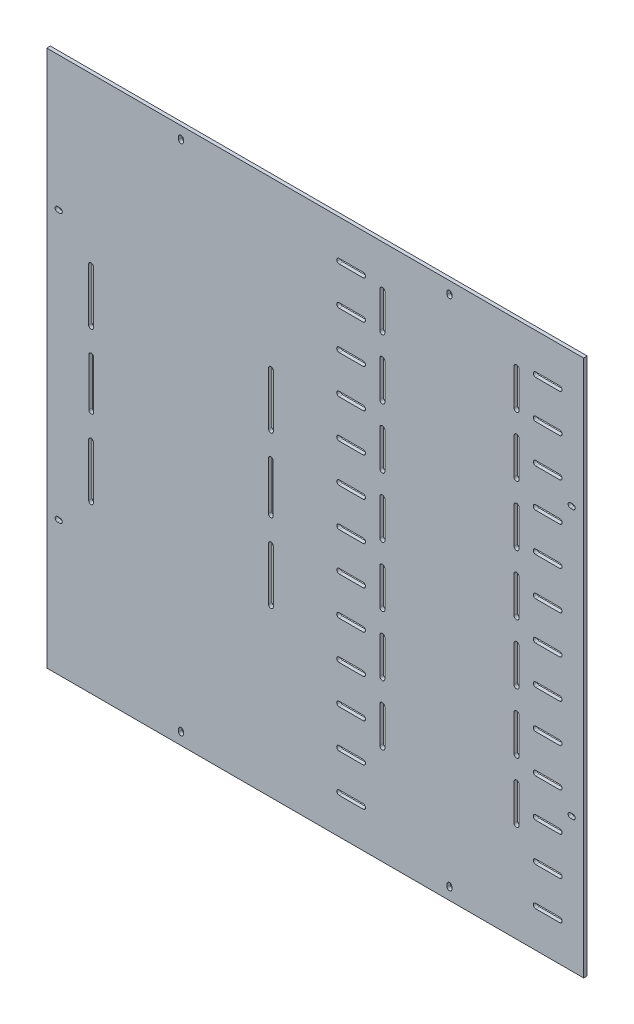
from build123d import *

# Parameters (mm, degrees)
SCHIZZO1_W                   = 448
SCHIZZO1_H                   = 448
ESTRUSIONE_ESTRUSIONE1_DEPTH = 3


with BuildPart() as part:
    # Schizzo1 → Estrusione-Estrusione1 (new body)
    with BuildSketch(Plane.XY):
        with Locations((224, 224)):
            Rectangle(SCHIZZO1_W, SCHIZZO1_H)
        with BuildLine():
            Line((9, 338), (11, 338))
            ThreePointArc((11, 338), (13, 336), (11, 334))
            Line((11, 334), (9, 334))
            ThreePointArc((9, 334), (7, 336), (9, 338))
        make_face(mode=Mode.SUBTRACT)
        with BuildLine():
            Line((9, 110), (11, 110))
            ThreePointArc((11, 110), (13, 112), (11, 114))
            Line((11, 114), (9, 114))
            ThreePointArc((9, 114), (7, 112), (9, 110))
        make_face(mode=Mode.SUBTRACT)
        with BuildLine():
            Line((439, 110), (437, 110))
            ThreePointArc((437, 110), (435, 112), (437, 114))
            Line((437, 114), (439, 114))
            ThreePointArc((439, 114), (441, 112), (439, 110))
        make_face(mode=Mode.SUBTRACT)
        with BuildLine():
            Line((439, 338), (437, 338))
            ThreePointArc((437, 338), (435, 336), (437, 334))
            Line((437, 334), (439, 334))
            ThreePointArc((439, 334), (441, 336), (439, 338))
        make_face(mode=Mode.SUBTRACT)
        with BuildLine():
            Line((114, 439), (114, 437))
            ThreePointArc((114, 437), (112, 435), (110, 437))
            Line((110, 437), (110, 439))
            ThreePointArc((110, 439), (112, 441), (114, 439))
        make_face(mode=Mode.SUBTRACT)
        with BuildLine():
            Line((334, 439), (334, 437))
            ThreePointArc((334, 437), (336, 435), (338, 437))
            Line((338, 437), (338, 439))
            ThreePointArc((338, 439), (336, 441), (334, 439))
        make_face(mode=Mode.SUBTRACT)
        with BuildLine():
            Line((114, 9), (114, 11))
            ThreePointArc((114, 11), (112, 13), (110, 11))
            Line((110, 11), (110, 9))
            ThreePointArc((110, 9), (112, 7), (114, 9))
        make_face(mode=Mode.SUBTRACT)
        with BuildLine():
            Line((334, 9), (334, 11))
            ThreePointArc((334, 11), (336, 13), (338, 11))
            Line((338, 11), (338, 9))
            ThreePointArc((338, 9), (336, 7), (334, 9))
        make_face(mode=Mode.SUBTRACT)
        with BuildLine():
            Line((34.958788995, 265.366145204), (34.958788995, 309.366145204))
            ThreePointArc((34.958788995, 309.366145204), (36.958788995, 311.366145204), (38.958788995, 309.366145204))
            Line((38.958788995, 309.366145204), (38.958788995, 265.366145204))
            ThreePointArc((38.958788995, 265.366145204), (36.958788995, 263.366145204), (34.958788995, 265.366145204))
        make_face(mode=Mode.SUBTRACT)
        with BuildLine():
            Line((34.958788995, 182.633854796), (34.958788995, 138.633854796))
            ThreePointArc((34.958788995, 138.633854796), (36.958788995, 136.633854796), (38.958788995, 138.633854796))
            Line((38.958788995, 138.633854796), (38.958788995, 182.633854796))
            ThreePointArc((38.958788995, 182.633854796), (36.958788995, 184.633854796), (34.958788995, 182.633854796))
        make_face(mode=Mode.SUBTRACT)
        with BuildLine():
            Line((35.086959829, 204.138830615), (35.086959829, 244.138830615))
            ThreePointArc((35.086959829, 244.138830615), (37.086959829, 246.138830615), (39.086959829, 244.138830615))
            Line((39.086959829, 244.138830615), (39.086959829, 204.138830615))
            ThreePointArc((39.086959829, 204.138830615), (37.086959829, 202.138830615), (35.086959829, 204.138830615))
        make_face(mode=Mode.SUBTRACT)
        with BuildLine():
            Line((189.041211005, 265.366145204), (189.041211005, 309.366145204))
            ThreePointArc((189.041211005, 309.366145204), (187.041211005, 311.366145204), (185.041211005, 309.366145204))
            Line((185.041211005, 309.366145204), (185.041211005, 265.366145204))
            ThreePointArc((185.041211005, 265.366145204), (187.041211005, 263.366145204), (189.041211005, 265.366145204))
        make_face(mode=Mode.SUBTRACT)
        with BuildLine():
            Line((188.913040171, 204.138830615), (188.913040171, 244.138830615))
            ThreePointArc((188.913040171, 244.138830615), (186.913040171, 246.138830615), (184.913040171, 244.138830615))
            Line((184.913040171, 244.138830615), (184.913040171, 204.138830615))
            ThreePointArc((184.913040171, 204.138830615), (186.913040171, 202.138830615), (188.913040171, 204.138830615))
        make_face(mode=Mode.SUBTRACT)
        with BuildLine():
            Line((189.041211005, 182.633854796), (189.041211005, 138.633854796))
            ThreePointArc((189.041211005, 138.633854796), (187.041211005, 136.633854796), (185.041211005, 138.633854796))
            Line((185.041211005, 138.633854796), (185.041211005, 182.633854796))
            ThreePointArc((185.041211005, 182.633854796), (187.041211005, 184.633854796), (189.041211005, 182.633854796))
        make_face(mode=Mode.SUBTRACT)
        with BuildLine():
            Line((243.970716252, 418), (263.970716252, 418))
            ThreePointArc((263.970716252, 418), (265.970716252, 416), (263.970716252, 414))
            Line((263.970716252, 414), (243.970716252, 414))
            ThreePointArc((243.970716252, 414), (241.970716252, 416), (243.970716252, 418))
        make_face(mode=Mode.SUBTRACT)
        with BuildLine():
            Line((427.970329998, 418.017724106), (407.970330369, 418.013871032))
            ThreePointArc((407.970330369, 418.013871032), (405.970715714, 416.013485761), (407.971100984, 414.013871106))
            Line((407.971100984, 414.013871106), (427.971100613, 414.017724181))
            ThreePointArc((427.971100613, 414.017724181), (429.970715268, 416.018109451), (427.970329998, 418.017724106))
        make_face(mode=Mode.SUBTRACT)
        with BuildLine():
            Line((243.970716252, 386), (263.970716252, 386))
            ThreePointArc((263.970716252, 386), (265.970716252, 384), (263.970716252, 382))
            Line((263.970716252, 382), (243.970716252, 382))
            ThreePointArc((243.970716252, 382), (241.970716252, 384), (243.970716252, 386))
        make_face(mode=Mode.SUBTRACT)
        with BuildLine():
            Line((427.970329998, 386.017724106), (407.970330369, 386.013871032))
            ThreePointArc((407.970330369, 386.013871032), (405.970715714, 384.013485761), (407.971100984, 382.013871106))
            Line((407.971100984, 382.013871106), (427.971100613, 382.017724181))
            ThreePointArc((427.971100613, 382.017724181), (429.970715268, 384.018109451), (427.970329998, 386.017724106))
        make_face(mode=Mode.SUBTRACT)
        with BuildLine():
            Line((277.872450261, 383.004982615), (277.872450261, 412.995017385))
            ThreePointArc((277.872450261, 412.995017385), (279.972450256, 415.09501738), (282.072450251, 412.995017385))
            Line((282.072450251, 412.995017385), (282.072450251, 383.004982615))
            ThreePointArc((282.072450251, 383.004982615), (279.972450256, 380.90498262), (277.872450261, 383.004982615))
        make_face(mode=Mode.SUBTRACT)
        with BuildLine():
            Line((243.970716252, 354), (263.970716252, 354))
            ThreePointArc((263.970716252, 354), (265.970716252, 352), (263.970716252, 350))
            Line((263.970716252, 350), (243.970716252, 350))
            ThreePointArc((243.970716252, 350), (241.970716252, 352), (243.970716252, 354))
        make_face(mode=Mode.SUBTRACT)
        with BuildLine():
            Line((427.970329998, 354.017724106), (407.970330369, 354.013871032))
            ThreePointArc((407.970330369, 354.013871032), (405.970715714, 352.013485761), (407.971100984, 350.013871106))
            Line((407.971100984, 350.013871106), (427.971100613, 350.017724181))
            ThreePointArc((427.971100613, 350.017724181), (429.970715268, 352.018109451), (427.970329998, 354.017724106))
        make_face(mode=Mode.SUBTRACT)
        with BuildLine():
            Line((243.970716252, 322), (263.970716252, 322))
            ThreePointArc((263.970716252, 322), (265.970716252, 320), (263.970716252, 318))
            Line((263.970716252, 318), (243.970716252, 318))
            ThreePointArc((243.970716252, 318), (241.970716252, 320), (243.970716252, 322))
        make_face(mode=Mode.SUBTRACT)
        with BuildLine():
            Line((427.970329998, 322.017724106), (407.970330369, 322.013871032))
            ThreePointArc((407.970330369, 322.013871032), (405.970715714, 320.013485761), (407.971100984, 318.013871106))
            Line((407.971100984, 318.013871106), (427.971100613, 318.017724181))
            ThreePointArc((427.971100613, 318.017724181), (429.970715268, 320.018109451), (427.970329998, 322.017724106))
        make_face(mode=Mode.SUBTRACT)
        with BuildLine():
            Line((394.072449736, 383.005806193), (394.072449736, 413.015771025))
            ThreePointArc((394.072449736, 413.015771025), (391.972449736, 415.115771025), (389.872449736, 413.015771025))
            Line((389.872449736, 413.015771025), (389.872449736, 383.005806193))
            ThreePointArc((389.872449736, 383.005806193), (391.972449736, 380.905806193), (394.072449736, 383.005806193))
        make_face(mode=Mode.SUBTRACT)
        with BuildLine():
            Line((243.970716252, 290), (263.970716252, 290))
            ThreePointArc((263.970716252, 290), (265.970716252, 288), (263.970716252, 286))
            Line((263.970716252, 286), (243.970716252, 286))
            ThreePointArc((243.970716252, 286), (241.970716252, 288), (243.970716252, 290))
        make_face(mode=Mode.SUBTRACT)
        with BuildLine():
            Line((427.970329998, 290.017724106), (407.970330369, 290.013871032))
            ThreePointArc((407.970330369, 290.013871032), (405.970715714, 288.013485761), (407.971100984, 286.013871106))
            Line((407.971100984, 286.013871106), (427.971100613, 286.017724181))
            ThreePointArc((427.971100613, 286.017724181), (429.970715268, 288.018109451), (427.970329998, 290.017724106))
        make_face(mode=Mode.SUBTRACT)
        with BuildLine():
            Line((243.970716252, 258), (263.970716252, 258))
            ThreePointArc((263.970716252, 258), (265.970716252, 256), (263.970716252, 254))
            Line((263.970716252, 254), (243.970716252, 254))
            ThreePointArc((243.970716252, 254), (241.970716252, 256), (243.970716252, 258))
        make_face(mode=Mode.SUBTRACT)
        with BuildLine():
            Line((427.970329998, 258.017724106), (407.970330369, 258.013871032))
            ThreePointArc((407.970330369, 258.013871032), (405.970715714, 256.013485761), (407.971100984, 254.013871106))
            Line((407.971100984, 254.013871106), (427.971100613, 254.017724181))
            ThreePointArc((427.971100613, 254.017724181), (429.970715268, 256.018109451), (427.970329998, 258.017724106))
        make_face(mode=Mode.SUBTRACT)
        with BuildLine():
            Line((243.970716252, 226), (263.970716252, 226))
            ThreePointArc((263.970716252, 226), (265.970716252, 224), (263.970716252, 222))
            Line((263.970716252, 222), (243.970716252, 222))
            ThreePointArc((243.970716252, 222), (241.970716252, 224), (243.970716252, 226))
        make_face(mode=Mode.SUBTRACT)
        with BuildLine():
            Line((427.970329998, 226.017724106), (407.970330369, 226.013871032))
            ThreePointArc((407.970330369, 226.013871032), (405.970715714, 224.013485761), (407.971100984, 222.013871106))
            Line((407.971100984, 222.013871106), (427.971100613, 222.017724181))
            ThreePointArc((427.971100613, 222.017724181), (429.970715268, 224.018109451), (427.970329998, 226.017724106))
        make_face(mode=Mode.SUBTRACT)
        with BuildLine():
            Line((243.970716252, 194), (263.970716252, 194))
            ThreePointArc((263.970716252, 194), (265.970716252, 192), (263.970716252, 190))
            Line((263.970716252, 190), (243.970716252, 190))
            ThreePointArc((243.970716252, 190), (241.970716252, 192), (243.970716252, 194))
        make_face(mode=Mode.SUBTRACT)
        with BuildLine():
            Line((427.970329998, 194.017724106), (407.970330369, 194.013871032))
            ThreePointArc((407.970330369, 194.013871032), (405.970715714, 192.013485761), (407.971100984, 190.013871106))
            Line((407.971100984, 190.013871106), (427.971100613, 190.017724181))
            ThreePointArc((427.971100613, 190.017724181), (429.970715268, 192.018109451), (427.970329998, 194.017724106))
        make_face(mode=Mode.SUBTRACT)
        with BuildLine():
            Line((243.970716252, 162), (263.970716252, 162))
            ThreePointArc((263.970716252, 162), (265.970716252, 160), (263.970716252, 158))
            Line((263.970716252, 158), (243.970716252, 158))
            ThreePointArc((243.970716252, 158), (241.970716252, 160), (243.970716252, 162))
        make_face(mode=Mode.SUBTRACT)
        with BuildLine():
            Line((427.970329998, 162.017724106), (407.970330369, 162.013871032))
            ThreePointArc((407.970330369, 162.013871032), (405.970715714, 160.013485761), (407.971100984, 158.013871106))
            Line((407.971100984, 158.013871106), (427.971100613, 158.017724181))
            ThreePointArc((427.971100613, 158.017724181), (429.970715268, 160.018109451), (427.970329998, 162.017724106))
        make_face(mode=Mode.SUBTRACT)
        with BuildLine():
            Line((243.970716252, 130), (263.970716252, 130))
            ThreePointArc((263.970716252, 130), (265.970716252, 128), (263.970716252, 126))
            Line((263.970716252, 126), (243.970716252, 126))
            ThreePointArc((243.970716252, 126), (241.970716252, 128), (243.970716252, 130))
        make_face(mode=Mode.SUBTRACT)
        with BuildLine():
            Line((427.970329998, 130.017724106), (407.970330369, 130.013871032))
            ThreePointArc((407.970330369, 130.013871032), (405.970715714, 128.013485761), (407.971100984, 126.013871106))
            Line((407.971100984, 126.013871106), (427.971100613, 126.017724181))
            ThreePointArc((427.971100613, 126.017724181), (429.970715268, 128.018109451), (427.970329998, 130.017724106))
        make_face(mode=Mode.SUBTRACT)
        with BuildLine():
            Line((277.872450261, 333.004982615), (277.872450261, 362.995017385))
            ThreePointArc((277.872450261, 362.995017385), (279.972450256, 365.09501738), (282.072450251, 362.995017385))
            Line((282.072450251, 362.995017385), (282.072450251, 333.004982615))
            ThreePointArc((282.072450251, 333.004982615), (279.972450256, 330.90498262), (277.872450261, 333.004982615))
        make_face(mode=Mode.SUBTRACT)
        with BuildLine():
            Line((394.072449736, 333.005806193), (394.072449736, 363.015771025))
            ThreePointArc((394.072449736, 363.015771025), (391.972449736, 365.115771025), (389.872449736, 363.015771025))
            Line((389.872449736, 363.015771025), (389.872449736, 333.005806193))
            ThreePointArc((389.872449736, 333.005806193), (391.972449736, 330.905806193), (394.072449736, 333.005806193))
        make_face(mode=Mode.SUBTRACT)
        with BuildLine():
            Line((277.872450261, 283.004982615), (277.872450261, 312.995017385))
            ThreePointArc((277.872450261, 312.995017385), (279.972450256, 315.09501738), (282.072450251, 312.995017385))
            Line((282.072450251, 312.995017385), (282.072450251, 283.004982615))
            ThreePointArc((282.072450251, 283.004982615), (279.972450256, 280.90498262), (277.872450261, 283.004982615))
        make_face(mode=Mode.SUBTRACT)
        with BuildLine():
            Line((394.072449736, 283.005806193), (394.072449736, 313.015771025))
            ThreePointArc((394.072449736, 313.015771025), (391.972449736, 315.115771025), (389.872449736, 313.015771025))
            Line((389.872449736, 313.015771025), (389.872449736, 283.005806193))
            ThreePointArc((389.872449736, 283.005806193), (391.972449736, 280.905806193), (394.072449736, 283.005806193))
        make_face(mode=Mode.SUBTRACT)
        with BuildLine():
            Line((277.872450261, 233.004982615), (277.872450261, 262.995017385))
            ThreePointArc((277.872450261, 262.995017385), (279.972450256, 265.09501738), (282.072450251, 262.995017385))
            Line((282.072450251, 262.995017385), (282.072450251, 233.004982615))
            ThreePointArc((282.072450251, 233.004982615), (279.972450256, 230.90498262), (277.872450261, 233.004982615))
        make_face(mode=Mode.SUBTRACT)
        with BuildLine():
            Line((394.072449736, 233.005806193), (394.072449736, 263.015771025))
            ThreePointArc((394.072449736, 263.015771025), (391.972449736, 265.115771025), (389.872449736, 263.015771025))
            Line((389.872449736, 263.015771025), (389.872449736, 233.005806193))
            ThreePointArc((389.872449736, 233.005806193), (391.972449736, 230.905806193), (394.072449736, 233.005806193))
        make_face(mode=Mode.SUBTRACT)
        with BuildLine():
            Line((277.872450261, 183.004982615), (277.872450261, 212.995017385))
            ThreePointArc((277.872450261, 212.995017385), (279.972450256, 215.09501738), (282.072450251, 212.995017385))
            Line((282.072450251, 212.995017385), (282.072450251, 183.004982615))
            ThreePointArc((282.072450251, 183.004982615), (279.972450256, 180.90498262), (277.872450261, 183.004982615))
        make_face(mode=Mode.SUBTRACT)
        with BuildLine():
            Line((394.072449736, 183.005806193), (394.072449736, 213.015771025))
            ThreePointArc((394.072449736, 213.015771025), (391.972449736, 215.115771025), (389.872449736, 213.015771025))
            Line((389.872449736, 213.015771025), (389.872449736, 183.005806193))
            ThreePointArc((389.872449736, 183.005806193), (391.972449736, 180.905806193), (394.072449736, 183.005806193))
        make_face(mode=Mode.SUBTRACT)
        with BuildLine():
            Line((277.872450261, 133.004982615), (277.872450261, 162.995017385))
            ThreePointArc((277.872450261, 162.995017385), (279.972450256, 165.09501738), (282.072450251, 162.995017385))
            Line((282.072450251, 162.995017385), (282.072450251, 133.004982615))
            ThreePointArc((282.072450251, 133.004982615), (279.972450256, 130.90498262), (277.872450261, 133.004982615))
        make_face(mode=Mode.SUBTRACT)
        with BuildLine():
            Line((394.072449736, 133.005806193), (394.072449736, 163.015771025))
            ThreePointArc((394.072449736, 163.015771025), (391.972449736, 165.115771025), (389.872449736, 163.015771025))
            Line((389.872449736, 163.015771025), (389.872449736, 133.005806193))
            ThreePointArc((389.872449736, 133.005806193), (391.972449736, 130.905806193), (394.072449736, 133.005806193))
        make_face(mode=Mode.SUBTRACT)
        with BuildLine():
            Line((277.872450261, 83.004982615), (277.872450261, 112.995017385))
            ThreePointArc((277.872450261, 112.995017385), (279.972450256, 115.09501738), (282.072450251, 112.995017385))
            Line((282.072450251, 112.995017385), (282.072450251, 83.004982615))
            ThreePointArc((282.072450251, 83.004982615), (279.972450256, 80.90498262), (277.872450261, 83.004982615))
        make_face(mode=Mode.SUBTRACT)
        with BuildLine():
            Line((394.072449736, 83.005806193), (394.072449736, 113.015771025))
            ThreePointArc((394.072449736, 113.015771025), (391.972449736, 115.115771025), (389.872449736, 113.015771025))
            Line((389.872449736, 113.015771025), (389.872449736, 83.005806193))
            ThreePointArc((389.872449736, 83.005806193), (391.972449736, 80.905806193), (394.072449736, 83.005806193))
        make_face(mode=Mode.SUBTRACT)
        with BuildLine():
            Line((243.970716252, 98), (263.970716252, 98))
            ThreePointArc((263.970716252, 98), (265.970716252, 96), (263.970716252, 94))
            Line((263.970716252, 94), (243.970716252, 94))
            ThreePointArc((243.970716252, 94), (241.970716252, 96), (243.970716252, 98))
        make_face(mode=Mode.SUBTRACT)
        with BuildLine():
            Line((427.970329998, 98.017724106), (407.970330369, 98.013871032))
            ThreePointArc((407.970330369, 98.013871032), (405.970715714, 96.013485761), (407.971100984, 94.013871106))
            Line((407.971100984, 94.013871106), (427.971100613, 94.017724181))
            ThreePointArc((427.971100613, 94.017724181), (429.970715268, 96.018109451), (427.970329998, 98.017724106))
        make_face(mode=Mode.SUBTRACT)
        with BuildLine():
            Line((243.970716252, 66), (263.970716252, 66))
            ThreePointArc((263.970716252, 66), (265.970716252, 64), (263.970716252, 62))
            Line((263.970716252, 62), (243.970716252, 62))
            ThreePointArc((243.970716252, 62), (241.970716252, 64), (243.970716252, 66))
        make_face(mode=Mode.SUBTRACT)
        with BuildLine():
            Line((427.970329998, 66.017724106), (407.970330369, 66.013871032))
            ThreePointArc((407.970330369, 66.013871032), (405.970715714, 64.013485761), (407.971100984, 62.013871106))
            Line((407.971100984, 62.013871106), (427.971100613, 62.017724181))
            ThreePointArc((427.971100613, 62.017724181), (429.970715268, 64.018109451), (427.970329998, 66.017724106))
        make_face(mode=Mode.SUBTRACT)
        with BuildLine():
            Line((243.970716252, 34), (263.970716252, 34))
            ThreePointArc((263.970716252, 34), (265.970716252, 32), (263.970716252, 30))
            Line((263.970716252, 30), (243.970716252, 30))
            ThreePointArc((243.970716252, 30), (241.970716252, 32), (243.970716252, 34))
        make_face(mode=Mode.SUBTRACT)
        with BuildLine():
            Line((427.970329998, 34.017724106), (407.970330369, 34.013871032))
            ThreePointArc((407.970330369, 34.013871032), (405.970715714, 32.013485761), (407.971100984, 30.013871106))
            Line((407.971100984, 30.013871106), (427.971100613, 30.017724181))
            ThreePointArc((427.971100613, 30.017724181), (429.970715268, 32.018109451), (427.970329998, 34.017724106))
        make_face(mode=Mode.SUBTRACT)
    extrude(amount=-ESTRUSIONE_ESTRUSIONE1_DEPTH)


solid = part.part
